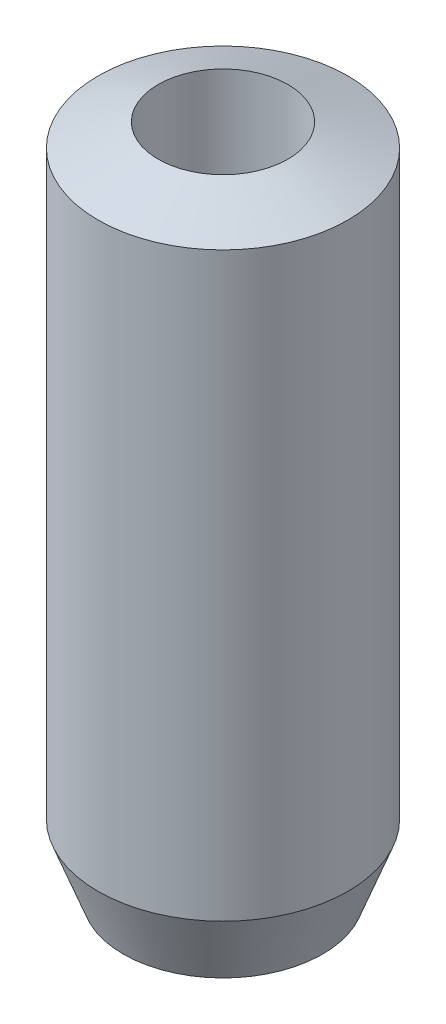
from build123d import *

# Parameters (mm, degrees)
SKETCH1_R           = 15
BOSS_EXTRUDE1_DEPTH = 80.901574
SKETCH2_R           = 7.783815441
CUT_EXTRUDE1_DEPTH  = 84.636503249
CHAMFER1_SIZE       = 3.030004
CHAMFER1_SIZE_2     = 8.044556


with BuildPart() as part:
    # Sketch1 → Boss-Extrude1 (new body)
    with BuildSketch(Plane(origin=(0, 0, 0), x_dir=(1, 0, 0), z_dir=(0, 1, 0))):
        with Locations(Location((0, 0, 0), (0, 0, 270))):
            Circle(SKETCH1_R)
    extrude(amount=BOSS_EXTRUDE1_DEPTH)

    # Sketch2 → Cut-Extrude1 (cut, through all)
    with BuildSketch(Plane(origin=(0, 0, 0), x_dir=(1, 0, 0), z_dir=(0, 1, 0))):
        with Locations(Location((0, 0, 0), (0, 0, 270))):
            Circle(SKETCH2_R)
    extrude(amount=CUT_EXTRUDE1_DEPTH, mode=Mode.SUBTRACT)

    # Chamfer1
    # the kernel refuses this chamfer: 8.044556, 3.030004 mm, written as the material it takes off along each edge
    with BuildSketch(Plane(origin=(0, 80.901574, 0), x_dir=(0, 0, 1), z_dir=(-1, 0, 0))) as chamfer1_piece_1:
        Polygon((15, -CHAMFER1_SIZE), (15 - CHAMFER1_SIZE_2, 0), (15, 0), align=None)
    revolve(axis=Axis((0, 80.901574, 0), (0, 1, 0)), mode=Mode.SUBTRACT)
    with BuildSketch(Plane(origin=(0, 0, 0), x_dir=(0, 0, 1), z_dir=(-1, 0, 0))) as chamfer1_piece_2:
        Polygon((15, CHAMFER1_SIZE_2), (15 - CHAMFER1_SIZE, 0), (15, 0), align=None)
    revolve(axis=Axis((0, 0, 0), (0, 1, 0)), mode=Mode.SUBTRACT)


solid = part.part
